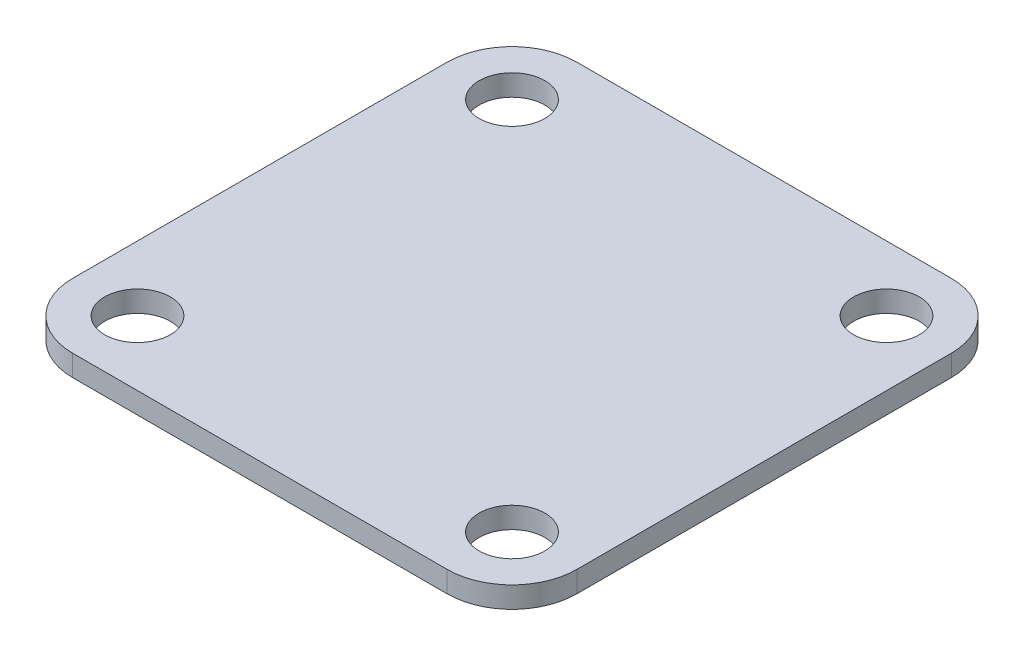
from build123d import *

# Parameters (mm, degrees)
SKETCH1_R           = 1.55
BOSS_EXTRUDE1_DEPTH = 1


with BuildPart() as part:
    # Sketch1 → Boss-Extrude1 (new body)
    with BuildSketch(Plane(origin=(0, 0, 0), x_dir=(1, 0, 0), z_dir=(0, 1, 0))):
        with BuildLine():
            Line((8.84, 11.9), (-8.84, 11.9))
            ThreePointArc((-8.84, 11.9), (-11.00374675, 11.00374675), (-11.9, 8.84))
            Line((-11.9, 8.84), (-11.9, -8.839999991))
            ThreePointArc((-11.9, -8.839999991), (-11.003746754, -11.003746747), (-8.84, -11.9))
            Line((-8.84, -11.9), (8.84, -11.9))
            ThreePointArc((8.84, -11.9), (11.00374675, -11.00374675), (11.9, -8.84))
            Line((11.9, -8.84), (11.9, 8.84))
            ThreePointArc((11.9, 8.84), (11.00374675, 11.00374675), (8.84, 11.9))
        make_face()
        with Locations((8.84, 8.84)):
            Circle(SKETCH1_R, mode=Mode.SUBTRACT)
        with Locations((-8.84, 8.84)):
            Circle(SKETCH1_R, mode=Mode.SUBTRACT)
        with Locations((8.84, -8.84)):
            Circle(SKETCH1_R, mode=Mode.SUBTRACT)
        with Locations((-8.84, -8.84)):
            Circle(SKETCH1_R, mode=Mode.SUBTRACT)
    extrude(amount=BOSS_EXTRUDE1_DEPTH)


solid = part.part
